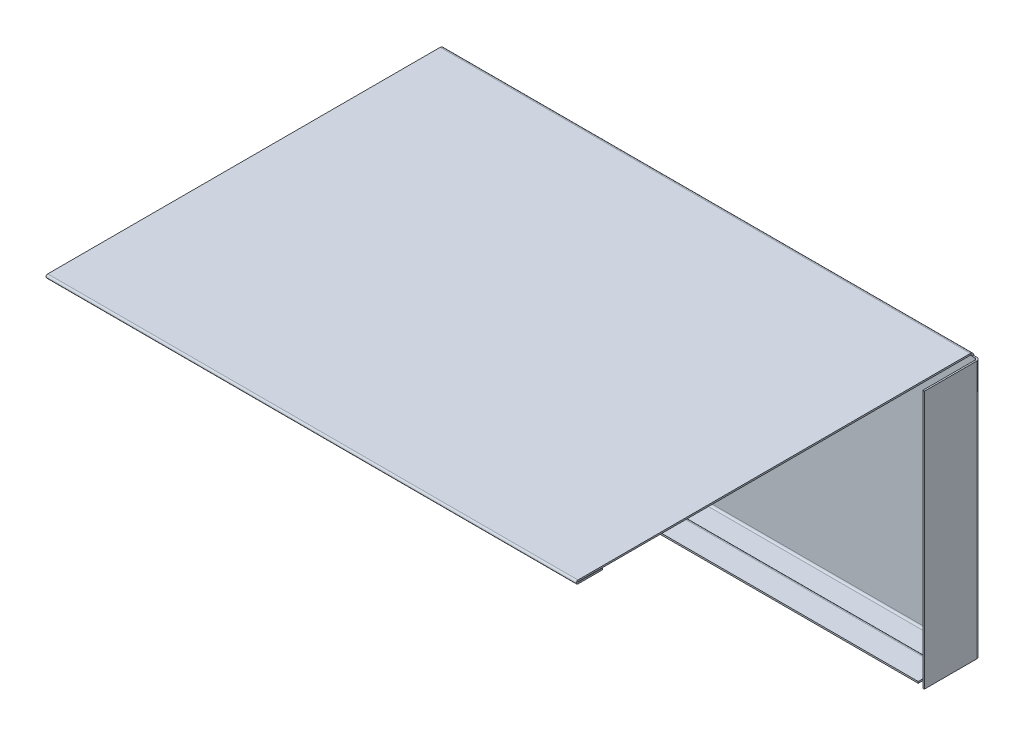
from build123d import *

# Parameters (mm, degrees)
SKETCH1_W                    = 100
SKETCH1_H                    = 200
BASE_FLANGE1_DEPTH           = 0.6
EDGE_FLANGE1_STRIP_W         = 3.8732
EDGE_FLANGE1_STRIP_H         = 0.6
EDGE_FLANGE1_STRIP_CUT_DEPTH = 200
EDGE_FLANGE1_DEPTH           = 200
HEM1_DEPTH                   = 200
HEM1_2_DEPTH                 = 200
EDGE_FLANGE2_STRIP_W         = 3.8732
EDGE_FLANGE2_STRIP_H         = 0.6
EDGE_FLANGE2_STRIP_CUT_DEPTH = 200
EDGE_FLANGE2_DEPTH           = 200
JOG2_DEPTH                   = 200
JOG2_2_DEPTH                 = 200
EDGE_FLANGE4_DEPTH           = 97.3268


# Read off the part's stored shape, not the designer's step: Hem1, Jog2
# Sheet-metal steps are written as plain solids
with BuildPart() as part:
    # Sketch1 → Base-Flange1 (new body)
    with BuildSketch(Plane(origin=(0, 0, 0), x_dir=(0, 1, 0), z_dir=(0, 0, 1))):
        with Locations((50, -100)):
            Rectangle(SKETCH1_W, SKETCH1_H)
    extrude(amount=-BASE_FLANGE1_DEPTH)

    # Edge-Flange1 strip (across the edge) → Edge-Flange1 strip cut (cut)
    with BuildSketch(Plane(origin=(200, 100, 0), x_dir=(0, -1, 0), z_dir=(-1, 0, 0))):
        with Locations((-0.6, -0.3)):
            Rectangle(EDGE_FLANGE1_STRIP_W, EDGE_FLANGE1_STRIP_H)
    extrude(amount=EDGE_FLANGE1_STRIP_CUT_DEPTH, mode=Mode.SUBTRACT)

    # Edge-Flange1 section (across the edge) → Edge-Flange1 (add)
    with BuildSketch(Plane(origin=(200, 100, 0), x_dir=(0, -1, 0), z_dir=(-1, 0, 0))):
        with BuildLine():
            Line((0, 0.7366), (0, 149.4))
            Line((0, 149.4), (0.6, 149.4))
            Line((0.6, 149.4), (0.6, 0.7366))
            ThreePointArc((0.6, 0.7366), (0.815745145, 0.215745145), (1.3366, 0))
            Line((1.3366, 0), (1.3366, -0.6))
            ThreePointArc((1.3366, -0.6), (0.391481076, -0.208518924), (0, 0.7366))
        make_face()
    extrude(amount=EDGE_FLANGE1_DEPTH)

    # Hem1 outline → Hem1 (cut)
    with BuildSketch(Plane.YZ):
        with BuildLine():
            Line((99.4, 149.4), (99.4, 149.39807407))
            ThreePointArc((99.4, 149.39807407), (99.826969601, 149.191588043), (100, 148.75))
            Line((100, 148.75), (100, 149.4))
            Line((100, 149.4), (99.4, 149.4))
        make_face()
    extrude(amount=HEM1_DEPTH, mode=Mode.SUBTRACT)

    # Hem1 2 outline → Hem1 2 (add)
    with BuildSketch(Plane.YZ):
        with BuildLine():
            Line((98.7, 139.4), (99.3, 139.4))
            Line((99.3, 139.4), (99.3, 148.75))
            ThreePointArc((99.3, 148.75), (99.35, 148.8), (99.4, 148.75))
            Line((99.4, 148.75), (99.4, 149.39807407))
            ThreePointArc((99.4, 149.39807407), (98.908411957, 149.226969601), (98.7, 148.75))
            Line((98.7, 148.75), (98.7, 139.4))
        make_face()
    extrude(amount=HEM1_2_DEPTH)

    # Edge-Flange2 strip (across the edge) → Edge-Flange2 strip cut (cut)
    with BuildSketch(Plane.YZ):
        with Locations((-0.6, -0.3)):
            Rectangle(EDGE_FLANGE2_STRIP_W, EDGE_FLANGE2_STRIP_H)
    extrude(amount=EDGE_FLANGE2_STRIP_CUT_DEPTH, mode=Mode.SUBTRACT)

    # Edge-Flange2 section (across the edge) → Edge-Flange2 (add)
    with BuildSketch(Plane.YZ):
        with BuildLine():
            Line((0, 0.7366), (0, 20.4))
            Line((0, 20.4), (0.6, 20.4))
            Line((0.6, 20.4), (0.6, 0.7366))
            ThreePointArc((0.6, 0.7366), (0.815745145, 0.215745145), (1.3366, 0))
            Line((1.3366, 0), (1.3366, -0.6))
            ThreePointArc((1.3366, -0.6), (0.391481076, -0.208518924), (0, 0.7366))
        make_face()
    extrude(amount=EDGE_FLANGE2_DEPTH)

    # Jog2 outline → Jog2 (cut)
    with BuildSketch(Plane.YZ):
        with BuildLine():
            ThreePointArc((0.6, 11.382443736), (0.440480949, 10.74921392), (0, 10.26713212))
            Line((0, 10.26713212), (0, 0.7366))
            ThreePointArc((0, 0.7366), (0.056516982, 0.352039176), (0.221288384, 0))
            Line((0.221288384, 0), (1.3366, 0))
            ThreePointArc((1.3366, 0), (0.815745145, 0.215745145), (0.6, 0.7366))
            Line((0.6, 0.7366), (0.6, 11.382443736))
        make_face()
        with BuildLine():
            ThreePointArc((97.705511616, 0), (97.223429816, -0.440480949), (96.5902, -0.6))
            Line((96.5902, -0.6), (98.6634, -0.6))
            ThreePointArc((98.6634, -0.6), (99.608518924, -0.208518924), (100, 0.7366))
            Line((100, 0.7366), (100, 148.75))
            ThreePointArc((100, 148.75), (99.35, 149.4), (98.7, 148.75))
            Line((98.7, 148.75), (98.7, 139.4))
            Line((98.7, 139.4), (99.3, 139.4))
            Line((99.3, 139.4), (99.3, 148.75))
            ThreePointArc((99.3, 148.75), (99.35, 148.8), (99.4, 148.75))
            Line((99.4, 148.75), (99.4, 0.7366))
            ThreePointArc((99.4, 0.7366), (99.184254855, 0.215745145), (98.6634, 0))
            Line((98.6634, 0), (97.705511616, 0))
        make_face()
    extrude(amount=JOG2_DEPTH, mode=Mode.SUBTRACT)

    # Jog2 2 outline → Jog2 2 (add)
    with BuildSketch(Plane.YZ):
        with BuildLine():
            ThreePointArc((-0.7366, 10.645843736), (-1.681718924, 10.25436266), (-2.0732, 9.309243736))
            Line((-2.0732, 9.309243736), (-2.0732, 0.7366))
            ThreePointArc((-2.0732, 0.7366), (-1.681718924, -0.208518924), (-0.7366, -0.6))
            Line((-0.7366, -0.6), (1.3366, -0.6))
            ThreePointArc((1.3366, -0.6), (0.703370184, -0.440480949), (0.221288384, 0))
            Line((0.221288384, 0), (-0.7366, 0))
            ThreePointArc((-0.7366, 0), (-1.257454855, 0.215745145), (-1.4732, 0.7366))
            Line((-1.4732, 0.7366), (-1.4732, 9.309243736))
            ThreePointArc((-1.4732, 9.309243736), (-1.257454855, 9.830098591), (-0.7366, 10.045843736))
            ThreePointArc((-0.7366, 10.045843736), (-0.352039176, 10.102360718), (0, 10.26713212))
            Line((0, 10.26713212), (0, 11.382443736))
            ThreePointArc((0, 11.382443736), (-0.215745145, 10.861588881), (-0.7366, 10.645843736))
        make_face()
        with BuildLine():
            Line((96.5902, 0), (97.705511616, 0))
            ThreePointArc((97.705511616, 0), (97.870283018, 0.352039176), (97.9268, 0.7366))
            Line((97.9268, 0.7366), (97.9268, 148.75))
            ThreePointArc((97.9268, 148.75), (97.2768, 149.4), (96.6268, 148.75))
            Line((96.6268, 148.75), (96.6268, 139.4))
            Line((96.6268, 139.4), (97.2268, 139.4))
            Line((97.2268, 139.4), (97.2268, 148.75))
            ThreePointArc((97.2268, 148.75), (97.2768, 148.8), (97.3268, 148.75))
            Line((97.3268, 148.75), (97.3268, 0.7366))
            ThreePointArc((97.3268, 0.7366), (97.111054855, 0.215745145), (96.5902, 0))
        make_face()
    extrude(amount=JOG2_2_DEPTH)

    # Edge-Flange4 section (across the edge) → Edge-Flange4 (add)
    with BuildSketch(Plane(origin=(201.7366, -0.7366, 0), x_dir=(-1, 0, 0), z_dir=(0, 1, 0))):
        with BuildLine():
            Line((-0.6, 0.7366), (-0.6, 20.4))
            Line((-0.6, 20.4), (0, 20.4))
            Line((0, 20.4), (0, 0.7366))
            ThreePointArc((0, 0.7366), (0.215745145, 0.215745145), (0.7366, 0))
            Line((0.7366, 0), (1.7366, 0))
            Line((1.7366, 0), (1.7366, -0.6))
            Line((1.7366, -0.6), (0.7366, -0.6))
            ThreePointArc((0.7366, -0.6), (-0.208518924, -0.208518924), (-0.6, 0.7366))
        make_face()
    extrude(amount=EDGE_FLANGE4_DEPTH)


solid = part.part
